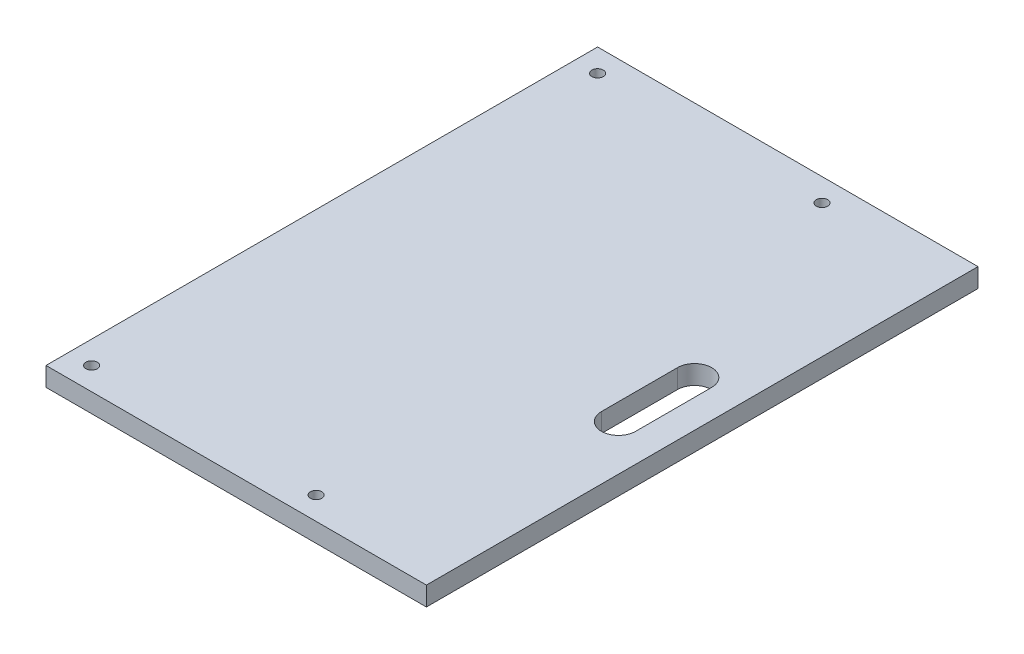
from build123d import *

# Parameters (mm, degrees)
SKETCH1_W           = 100
SKETCH1_H           = 145
BOSS_EXTRUDE1_DEPTH = 5
SKETCH2_R           = 1.5
CUT_EXTRUDE1_DEPTH  = 177.210101867


with BuildPart() as part:
    # Sketch1 → Boss-Extrude1 (new body)
    with BuildSketch(Plane(origin=(0, 0, 0), x_dir=(1, 0, 0), z_dir=(0, 1, 0))):
        with Locations((50, 72.5)):
            Rectangle(SKETCH1_W, SKETCH1_H)
        with BuildLine():
            Line((83.5, 82.5), (83.5, 62.5))
            ThreePointArc((83.5, 62.5), (88, 58), (92.5, 62.5))
            Line((92.5, 62.5), (92.5, 82.5))
            ThreePointArc((92.5, 82.5), (88, 87), (83.5, 82.5))
        make_face(mode=Mode.SUBTRACT)
    extrude(amount=BOSS_EXTRUDE1_DEPTH)

    # Sketch2 → Cut-Extrude1 (cut, through all)
    with BuildSketch(Plane(origin=(0, 5, 0), x_dir=(1, 0, 0), z_dir=(0, 1, 0))):
        with Locations((6, 139)):
            Circle(SKETCH2_R)
        with Locations((6, 6)):
            Circle(SKETCH2_R)
        with Locations((65, 139)):
            Circle(SKETCH2_R)
        with Locations((65, 6)):
            Circle(SKETCH2_R)
    extrude(amount=-CUT_EXTRUDE1_DEPTH, mode=Mode.SUBTRACT)


solid = part.part
